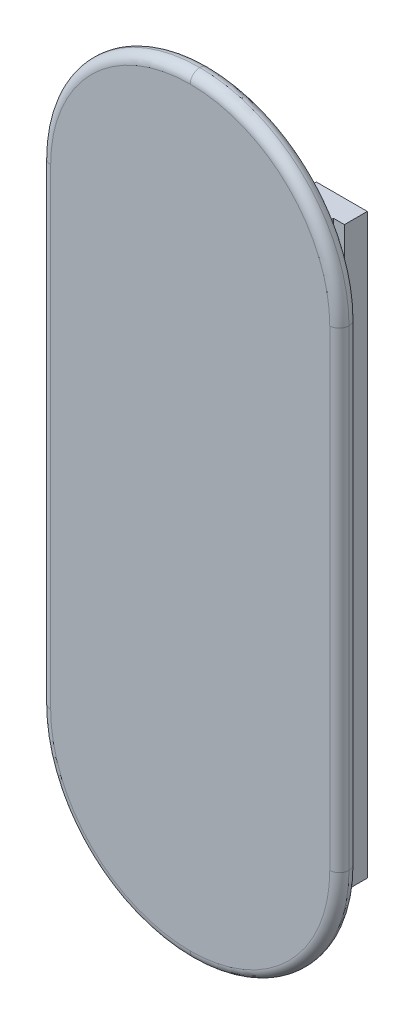
from build123d import *

# Parameters (mm, degrees)
SKETCH1_W                = 31
SKETCH1_H                = 80
BOSS_EXTRUDE1_DEPTH      = 2
FILLET1_R                = 15.5
BOSS_EXTRUDE2_DEPTH      = 30
BOSS_EXTRUDE2_DEPTH_BACK = 30
FILLET3_R                = 1


with BuildPart() as part:
    # Sketch1 → Boss-Extrude1 (new body)
    with BuildSketch(Plane.XY):
        Rectangle(SKETCH1_W, SKETCH1_H)
    extrude(amount=BOSS_EXTRUDE1_DEPTH)

    # Fillet1
    fillet1_edges = [part.edges().sort_by_distance(p)[0] for p in [
        (-15.5, 40, 1),
        (15.5, -40, 1),
        (-15.5, -40, 1),
        (15.5, 40, 1),
    ]]
    fillet(fillet1_edges, radius=FILLET1_R - 0.0001)  # a hair under: the kernel refuses the full size

    # Sketch2 → Boss-Extrude2 (add, two sides: drawn at the far end of the back side and taken through both)
    with BuildSketch(Plane(origin=(0, 0, 0), x_dir=(1, 0, 0), z_dir=(0, 1, 0)).offset(-BOSS_EXTRUDE2_DEPTH_BACK)):
        Polygon((-10.5, 0), (-7.5, 0), (-7.5, 2.375), (-6.35, 2.375), (-6.35, 4.75), (-7.5, 4.75), (-10.5, 4.75), (-11.65, 4.75), (-11.65, 2.375), (-10.5, 2.375), align=None)
        Polygon((10.5, 0), (10.5, 2.375), (11.65, 2.375), (11.65, 4.75), (6.35, 4.75), (6.35, 2.375), (7.5, 2.375), (7.5, 0), align=None)
    extrude(amount=BOSS_EXTRUDE2_DEPTH + BOSS_EXTRUDE2_DEPTH_BACK)

    # Fillet3
    fillet3_edges = [part.edges().sort_by_distance(p)[0] for p in [
        (-15.5, 0, 0),
        (-10.960184398, -35.460184398, 0),
        (10.960184398, -35.460184398, 0),
        (15.5, 0, 0),
        (10.960184398, 35.460184398, 0),
        (10.960184398, 35.460184398, 2),
        (15.5, 0, 2),
        (10.960184398, -35.460184398, 2),
        (-10.960184398, -35.460184398, 2),
        (-15.5, 0, 2),
        (-10.960184398, 35.460184398, 0),
        (-10.960184398, 35.460184398, 2),
    ]]
    fillet(fillet3_edges, radius=FILLET3_R - 0.0001)  # a hair under: the kernel refuses the full size


solid = part.part
